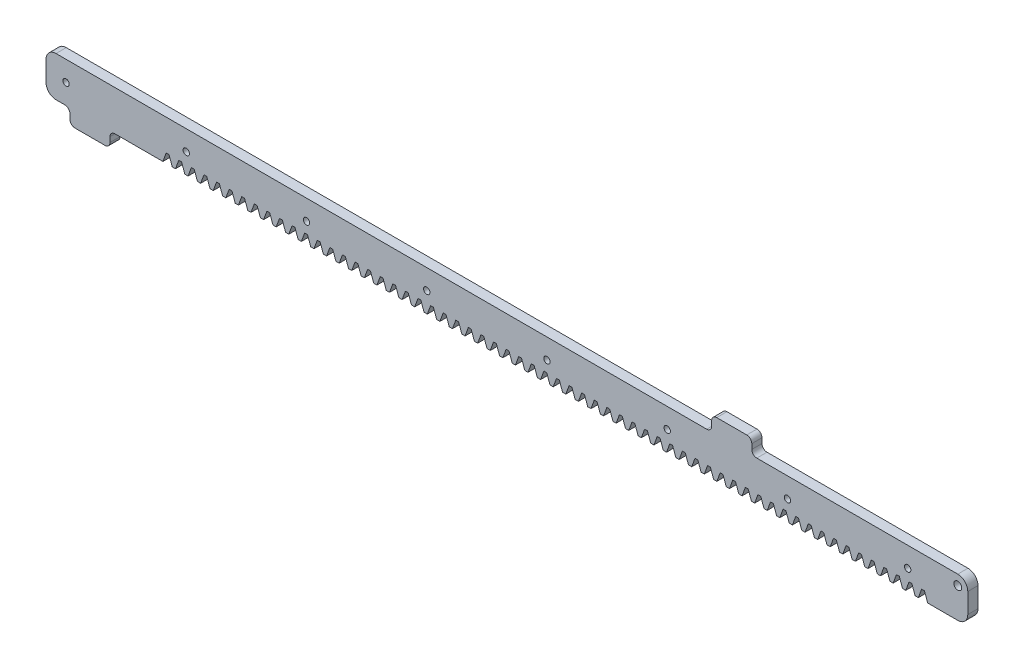
from build123d import *

# Parameters (mm, degrees)
SKETCH1_R           = 2.4892
BOSS_EXTRUDE1_DEPTH = 6.477
FILLET2_R           = 6.35
CUT_EXTRUDE1_DEPTH  = 586.278862726
LPATTERN1_COUNT     = 61
LPATTERN1_PITCH     = 7.979645331
SKETCH3_R           = 2.0193
CUT_EXTRUDE2_DEPTH  = 586.278862726
LPATTERN2_COUNT     = 8
LPATTERN2_PITCH     = 76.2
FILLET3_R           = 3.175


with BuildPart() as part:
    # Sketch1 → Boss-Extrude1 (new body)
    with BuildSketch(Plane.XY):
        Polygon((0, 25.4), (0, 0), (15.130665192, 0), (15.130665192, -9.525), (40.530665192, -9.525), (40.530665192, 0), (584.2, 0), (584.2, 25.4), (533.4, 25.4), (447.303292844, 25.4), (447.303292844, 34.925), (421.903292844, 34.925), (421.903292844, 25.4), (40.53078, 25.4), align=None)
        with Locations((577.85, 19.05)):
            Circle(SKETCH1_R, mode=Mode.SUBTRACT)
    extrude(amount=BOSS_EXTRUDE1_DEPTH)

    # Fillet2
    fillet2_edges = [part.edges().sort_by_distance(p)[0] for p in [
        (0, 0, 3.2385),
        (0, 25.4, 3.2385),
        (584.2, 25.4, 3.2385),
        (584.2, 0, 3.2385),
    ]]
    fillet(fillet2_edges, radius=FILLET2_R)

    # Sketch2 → Cut-Extrude1 (cut, through all)
    with BuildSketch(Plane.XY.offset(6.477)):
        Polygon((552.86876001, 0), (558.8, 0), (556.719910111, 5.715), (554.948849899, 5.715), align=None)
    cut_extrude1 = extrude(amount=-CUT_EXTRUDE1_DEPTH, mode=Mode.SUBTRACT)

    # LPattern1: Cut-Extrude1 ×61
    with Locations(*[(-i * LPATTERN1_PITCH, 0, 0) for i in range(1, LPATTERN1_COUNT)]):
        add(cut_extrude1, mode=Mode.SUBTRACT)

    # Sketch3 → Cut-Extrude2 (cut, through all)
    with BuildSketch(Plane.XY.offset(6.477)):
        with Locations((546.1, 12.7)):
            Circle(SKETCH3_R)
    cut_extrude2 = extrude(amount=-CUT_EXTRUDE2_DEPTH, mode=Mode.SUBTRACT)

    # LPattern2: Cut-Extrude2 ×8
    with Locations(*[(-i * LPATTERN2_PITCH, 0, 0) for i in range(1, LPATTERN2_COUNT)]):
        add(cut_extrude2, mode=Mode.SUBTRACT)

    # Fillet3
    fillet3_edges = [part.edges().sort_by_distance(p)[0] for p in [
        (421.903292844, 25.4, 3.2385),
        (421.903292844, 34.925, 3.2385),
        (447.303292844, 34.925, 3.2385),
        (447.303292844, 25.4, 3.2385),
        (40.530665192, -9.525, 3.2385),
        (40.530665192, 0, 3.2385),
        (15.130665192, -9.525, 3.2385),
        (15.130665192, 0, 3.2385),
    ]]
    fillet(fillet3_edges, radius=FILLET3_R)


solid = part.part
